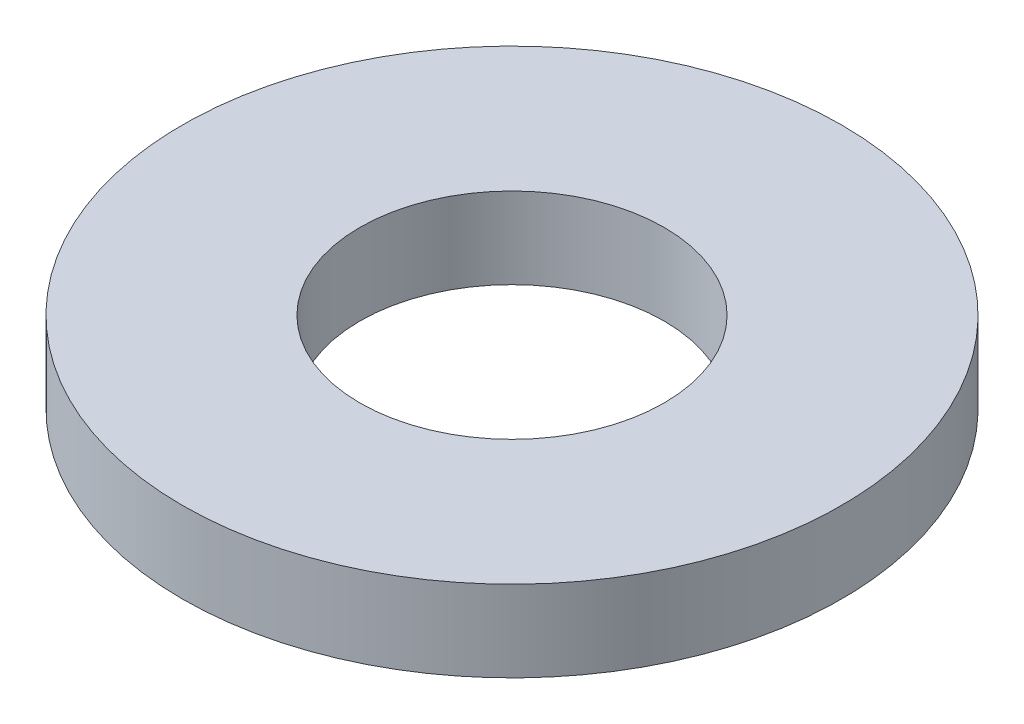
from build123d import *

# Parameters (mm, degrees)
SKETCH1_R           = 97.5
BOSS_EXTRUDE1_DEPTH = 24
SKETCH2_R           = 45
CUT_EXTRUDE1_DEPTH  = 140.958922545


with BuildPart() as part:
    # Sketch1 → Boss-Extrude1 (new body)
    with BuildSketch(Plane(origin=(0, 0, 0), x_dir=(1, 0, 0), z_dir=(0, 1, 0))):
        Circle(SKETCH1_R)
    extrude(amount=BOSS_EXTRUDE1_DEPTH)

    # Sketch2 → Cut-Extrude1 (cut, through all)
    with BuildSketch(Plane(origin=(0, 0, 0), x_dir=(1, 0, 0), z_dir=(0, 1, 0))):
        Circle(SKETCH2_R)
    extrude(amount=CUT_EXTRUDE1_DEPTH, mode=Mode.SUBTRACT)


solid = part.part
